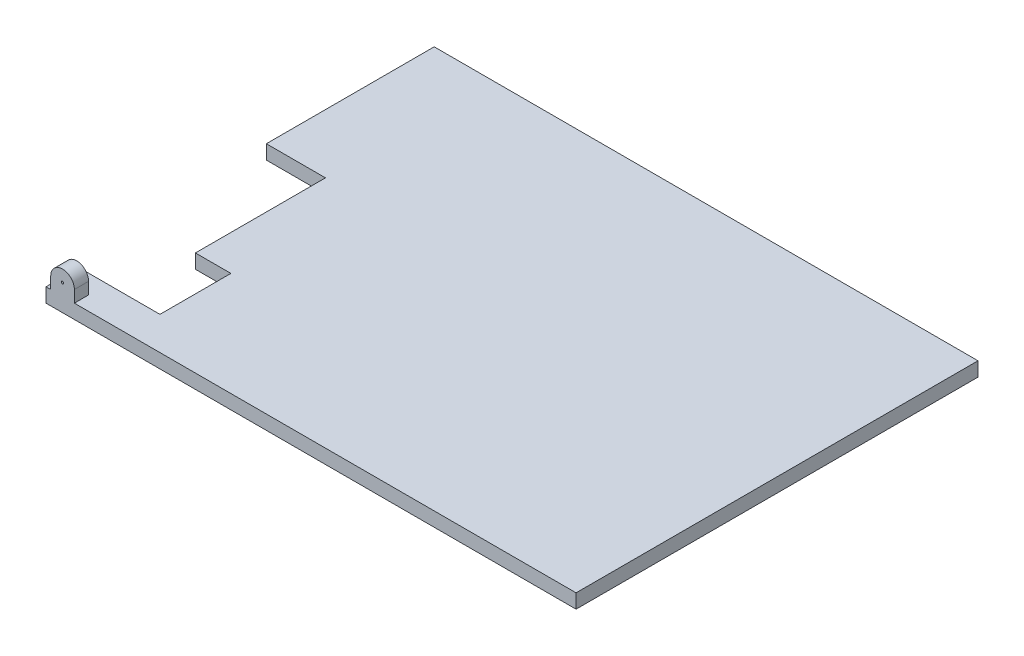
from build123d import *

# Parameters (mm, degrees)
BOSS_EXTRUDE1_DEPTH = 6
SKETCH2_R           = 0.5
BOSS_EXTRUDE2_DEPTH = 6


with BuildPart() as part:
    # Sketch1 → Boss-Extrude1 (new body)
    with BuildSketch(Plane(origin=(0, 0, 0), x_dir=(1, 0, 0), z_dir=(0, 1, 0))):
        Polygon((5.804365786, 4.796692747), (230, 4.796692747), (230, 174.796692747), (0, 174.796692747), (0, 103.796692747), (25, 103.796692747), (25, 48.796692747), (40, 48.796692747), (40, 18.796692747), (25, 18.796692747), (18.804365786, 18.796692747), (5.804365786, 18.796692747), align=None)
    extrude(amount=BOSS_EXTRUDE1_DEPTH)

    # Sketch2 → Boss-Extrude2 (add)
    with BuildSketch(Plane.XY.offset(-4.796692747)):
        with BuildLine():
            Line((7.804365786, 6), (17.804365786, 6))
            Line((17.804365786, 6), (17.804365786, 11))
            ThreePointArc((17.804365786, 11), (12.804365786, 16), (7.804365786, 11))
            Line((7.804365786, 11), (7.804365786, 6))
        make_face()
        with Locations((12.804365786, 11)):
            Circle(SKETCH2_R, mode=Mode.SUBTRACT)
    extrude(amount=-BOSS_EXTRUDE2_DEPTH)


solid = part.part
